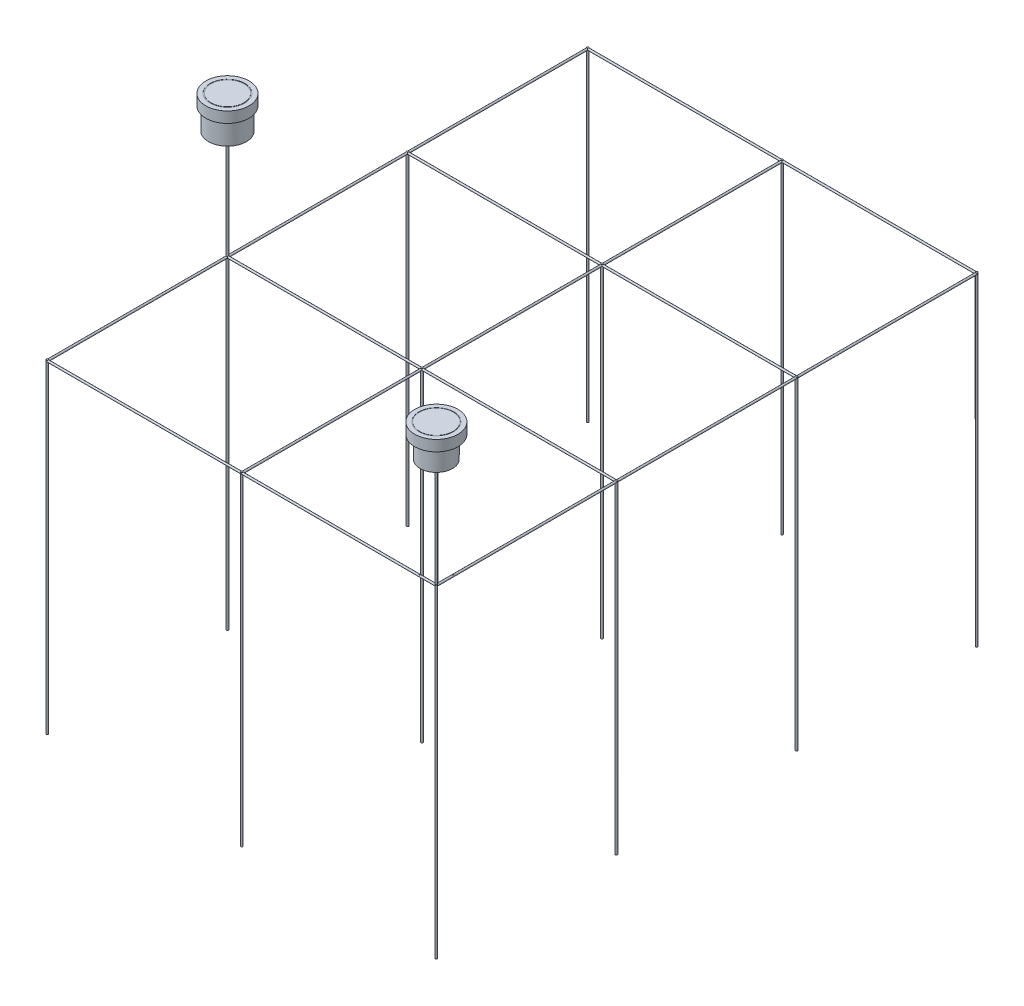
from build123d import *
from build123d.topology import SkipClean

# Parameters (mm, degrees)
CROQUIS1_R               = 9
SALIENTE_EXTRUIR1_DEPTH  = 3000
CROQUIS2_R               = 9
SALIENTE_EXTRUIR2_DEPTH  = 5000
MATRIZL2_COUNT           = 4
MATRIZL2_PITCH           = 1666.666666667
CROQUIS3_R               = 9
SALIENTE_EXTRUIR3_DEPTH  = 3600
MATRIZL4_COUNT           = 3
MATRIZL4_PITCH           = 1800
MATRIZL5_COUNT           = 3
MATRIZL5_PITCH           = 1800
MATRIZL6_COPY_1_SKETCH_R = 9
MATRIZL6_COPY_1_DEPTH    = 3000
MATRIZL6_COPY_2_SKETCH_R = 9
MATRIZL6_COPY_2_DEPTH    = 3000
MATRIZL6_COPY_3_SKETCH_R = 9
MATRIZL6_COPY_3_DEPTH    = 3000
MATRIZL6_COPY_4_SKETCH_R = 9
MATRIZL6_COPY_4_DEPTH    = 3000
MATRIZL6_COPY_5_SKETCH_R = 9
MATRIZL6_COPY_5_DEPTH    = 3000
MATRIZL6_COPY_6_SKETCH_R = 9
MATRIZL6_COPY_6_DEPTH    = 3000
MATRIZL6_COPY_7_SKETCH_R = 9
MATRIZL6_COPY_7_DEPTH    = 3000
MATRIZL6_COPY_8_SKETCH_R = 9
MATRIZL6_COPY_8_DEPTH    = 3000
MATRIZL6_COPY_9_SKETCH_R = 9
MATRIZL6_COPY_9_DEPTH    = 3000
MATRIZL7_COUNT           = 4
MATRIZL7_PITCH           = 1666.666666667
SALIENTE_EXTRUIR4_START  = 1300
CROQUIS4_R               = 9
SALIENTE_EXTRUIR4_DEPTH  = 1300
CROQUIS5_R               = 200
SALIENTE_EXTRUIR5_DEPTH  = 100
CROQUIS6_R               = 175
SALIENTE_EXTRUIR6_DEPTH  = 200
CROQUIS9_R               = 9.104274915
SALIENTE_EXTRUIR10_DEPTH = 1300
CROQUIS10_R              = 200
SALIENTE_EXTRUIR11_DEPTH = 100
CROQUIS11_R              = 160
CROQUIS11_R_2            = 151.594750353
CORTAR_EXTRUIR1_DEPTH    = 2
CROQUIS12_R              = 160
CROQUIS12_R_2            = 148.330176848
CORTAR_EXTRUIR2_DEPTH    = 2
CROQUIS13_R              = 160
CROQUIS13_R_2            = 155
CORTAR_EXTRUIR3_DEPTH    = 2
CROQUIS15_R              = 150
SALIENTE_EXTRUIR12_DEPTH = 200


with BuildPart() as part:
    # Croquis1 → Saliente-Extruir1 (new body)
    with BuildSketch(Plane(origin=(0, 0, 0), x_dir=(1, 0, 0), z_dir=(0, 1, 0))):
        Circle(CROQUIS1_R)
    saliente_extruir1 = extrude(amount=-SALIENTE_EXTRUIR1_DEPTH)

    # Croquis2 → Saliente-Extruir2 (add)
    with BuildSketch(Plane.XY):
        with Locations((0, -9)):
            Circle(CROQUIS2_R)
    saliente_extruir2 = extrude(amount=-SALIENTE_EXTRUIR2_DEPTH)

    # MatrizL2: Saliente-Extruir1 ×4
    with Locations(*[(0, 0, -i * MATRIZL2_PITCH) for i in range(1, MATRIZL2_COUNT)]):
        add(saliente_extruir1)

    # Croquis3 → Saliente-Extruir3 (add)
    with BuildSketch(Plane(origin=(0, 0, 0), x_dir=(0, 0, -1), z_dir=(1, 0, 0))):
        with Locations((0, -9)):
            Circle(CROQUIS3_R)
    saliente_extruir3 = extrude(amount=SALIENTE_EXTRUIR3_DEPTH)

    # MatrizL4: Saliente-Extruir1 ×3
    with Locations(*[(i * MATRIZL4_PITCH, 0, 0) for i in range(1, MATRIZL4_COUNT)]):
        add(saliente_extruir1)

    # MatrizL5: Saliente-Extruir2 ×3
    with SkipClean():  # the faces are left unmerged after this step: merging them gives an invalid solid
        with Locations(*[(i * MATRIZL5_PITCH, 0, 0) for i in range(1, MATRIZL5_COUNT)]):
            add(saliente_extruir2)

    # MatrizL6 copy 1 sketch → MatrizL6 copy 1 (add)
    with SkipClean():  # the faces are left unmerged after this step: merging them gives an invalid solid
        with BuildSketch(Plane(origin=(1800, 0, -1666.666666667), x_dir=(1, 0, 0), z_dir=(0, 1, 0))):
            Circle(MATRIZL6_COPY_1_SKETCH_R)
        extrude(amount=-MATRIZL6_COPY_1_DEPTH)

    # MatrizL6 copy 2 sketch → MatrizL6 copy 2 (add)
    with SkipClean():  # the faces are left unmerged after this step: merging them gives an invalid solid
        with BuildSketch(Plane(origin=(1800, 0, -3333.333333333), x_dir=(1, 0, 0), z_dir=(0, 1, 0))):
            Circle(MATRIZL6_COPY_2_SKETCH_R)
        extrude(amount=-MATRIZL6_COPY_2_DEPTH)

    # MatrizL6 copy 3 sketch → MatrizL6 copy 3 (add)
    with SkipClean():  # the faces are left unmerged after this step: merging them gives an invalid solid
        with BuildSketch(Plane(origin=(1800, 0, -5000), x_dir=(1, 0, 0), z_dir=(0, 1, 0))):
            Circle(MATRIZL6_COPY_3_SKETCH_R)
        extrude(amount=-MATRIZL6_COPY_3_DEPTH)

    # MatrizL6 copy 4 sketch → MatrizL6 copy 4 (add)
    with SkipClean():  # the faces are left unmerged after this step: merging them gives an invalid solid
        with BuildSketch(Plane(origin=(3600, 0, -1666.666666667), x_dir=(1, 0, 0), z_dir=(0, 1, 0))):
            Circle(MATRIZL6_COPY_4_SKETCH_R)
        extrude(amount=-MATRIZL6_COPY_4_DEPTH)

    # MatrizL6 copy 5 sketch → MatrizL6 copy 5 (add)
    with SkipClean():  # the faces are left unmerged after this step: merging them gives an invalid solid
        with BuildSketch(Plane(origin=(3600, 0, -3333.333333333), x_dir=(1, 0, 0), z_dir=(0, 1, 0))):
            Circle(MATRIZL6_COPY_5_SKETCH_R)
        extrude(amount=-MATRIZL6_COPY_5_DEPTH)

    # MatrizL6 copy 6 sketch → MatrizL6 copy 6 (add)
    with SkipClean():  # the faces are left unmerged after this step: merging them gives an invalid solid
        with BuildSketch(Plane(origin=(3600, 0, -5000), x_dir=(1, 0, 0), z_dir=(0, 1, 0))):
            Circle(MATRIZL6_COPY_6_SKETCH_R)
        extrude(amount=-MATRIZL6_COPY_6_DEPTH)

    # MatrizL6 copy 7 sketch → MatrizL6 copy 7 (add)
    with SkipClean():  # the faces are left unmerged after this step: merging them gives an invalid solid
        with BuildSketch(Plane(origin=(0, 0, -1666.666666667), x_dir=(1, 0, 0), z_dir=(0, 1, 0))):
            Circle(MATRIZL6_COPY_7_SKETCH_R)
        extrude(amount=-MATRIZL6_COPY_7_DEPTH)

    # MatrizL6 copy 8 sketch → MatrizL6 copy 8 (add)
    with SkipClean():  # the faces are left unmerged after this step: merging them gives an invalid solid
        with BuildSketch(Plane(origin=(0, 0, -3333.333333333), x_dir=(1, 0, 0), z_dir=(0, 1, 0))):
            Circle(MATRIZL6_COPY_8_SKETCH_R)
        extrude(amount=-MATRIZL6_COPY_8_DEPTH)

    # MatrizL6 copy 9 sketch → MatrizL6 copy 9 (add)
    with SkipClean():  # the faces are left unmerged after this step: merging them gives an invalid solid
        with BuildSketch(Plane(origin=(0, 0, -5000), x_dir=(1, 0, 0), z_dir=(0, 1, 0))):
            Circle(MATRIZL6_COPY_9_SKETCH_R)
        extrude(amount=-MATRIZL6_COPY_9_DEPTH)

    # MatrizL7: Saliente-Extruir3 ×4
    with SkipClean():  # the faces are left unmerged after this step: merging them gives an invalid solid
        with Locations(*[(0, 0, -i * MATRIZL7_PITCH) for i in range(1, MATRIZL7_COUNT)]):
            add(saliente_extruir3)

    # Croquis4 → Saliente-Extruir4 (add)
    with SkipClean():  # the faces are left unmerged after this step: merging them gives an invalid solid
        with BuildSketch(Plane(origin=(0, 0, 0), x_dir=(1, 0, 0), z_dir=(0, 1, 0)).offset(SALIENTE_EXTRUIR4_START)):
            with Locations((0, 1666.666666667)):
                Circle(CROQUIS4_R)
        extrude(amount=-SALIENTE_EXTRUIR4_DEPTH)

    # Croquis5 → Saliente-Extruir5 (add)
    with SkipClean():  # the faces are left unmerged after this step: merging them gives an invalid solid
        with BuildSketch(Plane(origin=(0, 1300, 0), x_dir=(1, 0, 0), z_dir=(0, 1, 0))):
            with Locations((0, 1666.666666667)):
                Circle(CROQUIS5_R)
        extrude(amount=-SALIENTE_EXTRUIR5_DEPTH)

    # Croquis6 → Saliente-Extruir6 (add)
    with SkipClean():  # the faces are left unmerged after this step: merging them gives an invalid solid
        with BuildSketch(Plane.XZ.offset(-1200)):
            with Locations((0, -1666.666666667)):
                Circle(CROQUIS6_R)
        extrude(amount=SALIENTE_EXTRUIR6_DEPTH)

    # Croquis11 → Cortar-Extruir1 (cut)
    with SkipClean():  # the faces are left unmerged after this step: merging them gives an invalid solid
        with BuildSketch(Plane(origin=(0, 1300, 0), x_dir=(1, 0, 0), z_dir=(0, 1, 0))):
            with Locations((0, 1666.666666667)):
                Circle(CROQUIS11_R)
            with Locations((0, 1666.666666667)):
                Circle(CROQUIS11_R_2, mode=Mode.SUBTRACT)
        extrude(amount=-CORTAR_EXTRUIR1_DEPTH, mode=Mode.SUBTRACT)

    # Croquis12 → Cortar-Extruir2 (cut)
    with SkipClean():  # the faces are left unmerged after this step: merging them gives an invalid solid
        with BuildSketch(Plane(origin=(0, 1, 0), x_dir=(1, 0, 0), z_dir=(0, 1, 0))):
            with Locations((3601.155712906, 0)):
                Circle(CROQUIS12_R)
            with Locations((3601.155712906, 0)):
                Circle(CROQUIS12_R_2, mode=Mode.SUBTRACT)
        extrude(amount=-CORTAR_EXTRUIR2_DEPTH, mode=Mode.SUBTRACT)


with BuildPart() as body_2:
    # Croquis9 → Saliente-Extruir10 (new body)
    with BuildSketch(Plane(origin=(0, 1, 0), x_dir=(1, 0, 0), z_dir=(0, 1, 0))):
        with Locations((3600, 0)):
            Circle(CROQUIS9_R)
    extrude(amount=SALIENTE_EXTRUIR10_DEPTH)

    # Croquis10 → Saliente-Extruir11 (add)
    with BuildSketch(Plane(origin=(0, 1301, 0), x_dir=(1, 0, 0), z_dir=(0, 1, 0))):
        with Locations((3600, 0)):
            Circle(CROQUIS10_R)
    extrude(amount=-SALIENTE_EXTRUIR11_DEPTH)

    # Croquis13 → Cortar-Extruir3 (cut)
    with BuildSketch(Plane(origin=(0, 1301, 0), x_dir=(1, 0, 0), z_dir=(0, 1, 0))):
        with Locations((3600, 0)):
            Circle(CROQUIS13_R)
        with Locations((3600, 0)):
            Circle(CROQUIS13_R_2, mode=Mode.SUBTRACT)
    extrude(amount=-CORTAR_EXTRUIR3_DEPTH, mode=Mode.SUBTRACT)

    # Croquis15 → Saliente-Extruir12 (add)
    with BuildSketch(Plane.XZ.offset(-1201)):
        with Locations((3600, 0)):
            Circle(CROQUIS15_R)
    extrude(amount=SALIENTE_EXTRUIR12_DEPTH)


solid = Compound([part.part, body_2.part])
